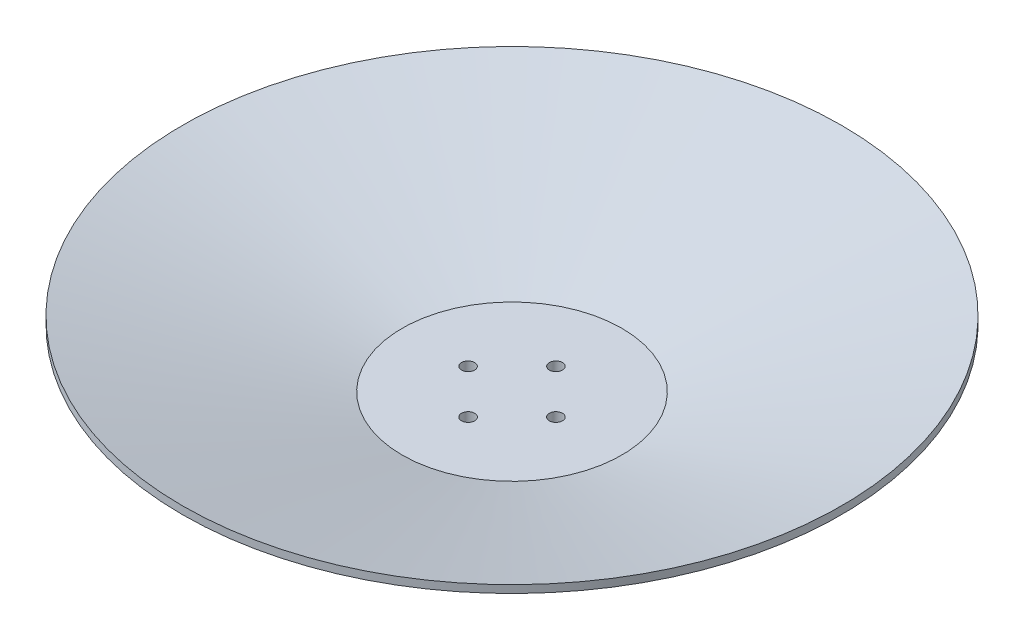
from build123d import *

# Parameters (mm, degrees)
SKETCH3_R          = 3
CUT_EXTRUDE1_DEPTH = 218.944947177


with BuildPart() as part:
    # Sketch2 → Revolve1 (revolve)
    with BuildSketch(Plane.XY):
        Polygon((0, 0), (35, 0), (43.234110893, 9.489398467), (150, 46.5), (150, 50), (50, 20), (0, 20), (0, 7.226614915), align=None)
    revolve(axis=Axis((0, 7.226614915, 0), (0, 1, 0)))

    # Sketch3 → Cut-Extrude1 (cut, through all)
    with BuildSketch(Plane.XZ):
        with Locations((0, 20)):
            Circle(SKETCH3_R)
        with Locations((20, 0)):
            Circle(SKETCH3_R)
        with Locations((0, -20)):
            Circle(SKETCH3_R)
        with Locations((-20, 0)):
            Circle(SKETCH3_R)
    extrude(amount=-CUT_EXTRUDE1_DEPTH, mode=Mode.SUBTRACT)


solid = part.part
